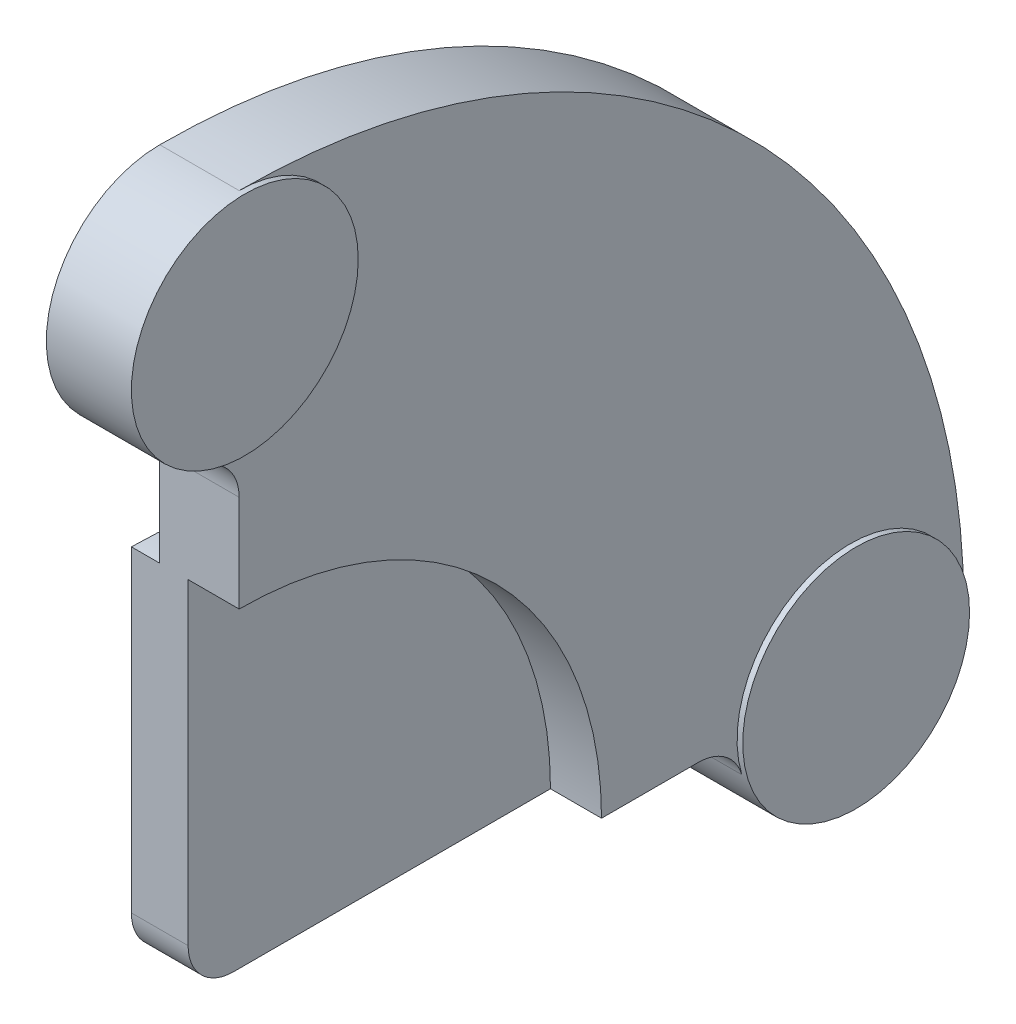
from build123d import *

# Parameters (mm, degrees)
SALIENTE_EXTRUIR1_DEPTH = 2.5
SALIENTE_EXTRUIR2_START = 7
SALIENTE_EXTRUIR2_DEPTH = 7
SALIENTE_EXTRUIR3_START = 7.5
CROQUIS2_4_R            = 10
SALIENTE_EXTRUIR3_DEPTH = 7.5
REDONDEO1_R             = 4
REDONDEO2_R             = 4


with BuildPart() as part:
    # Croquis2 → Saliente-Extruir1 (new, symmetric)
    with BuildSketch(Plane(origin=(0, 0, 0), x_dir=(0, 0, -1), z_dir=(1, 0, 0))):
        with BuildLine():
            ThreePointArc((31.95, 0), (22.592061659, 22.592061659), (0, 31.95))
            Line((0, 31.95), (0, 0))
            Line((0, 0), (31.95, 0))
        make_face()
    extrude(amount=SALIENTE_EXTRUIR1_DEPTH, both=True)

    # Croquis2<3> → Saliente-Extruir2 (add)
    with BuildSketch(Plane(origin=(0, 0, 0), x_dir=(0, 0, -1), z_dir=(1, 0, 0)).offset(SALIENTE_EXTRUIR2_START)):
        with BuildLine():
            ThreePointArc((10, 53.9), (7.071067812, 46.828932188), (0, 43.9))
            Line((0, 43.9), (0, 31.95))
            ThreePointArc((0, 31.95), (22.592061659, 22.592061659), (31.95, 0))
            Line((31.95, 0), (43.9, 0))
            ThreePointArc((43.9, 0), (53.9, 10), (63.9, 0))
            ThreePointArc((63.9, 0), (45.184123318, 45.184123318), (0, 63.9))
            ThreePointArc((0, 63.9), (7.071067812, 60.971067812), (10, 53.9))
        make_face()
    extrude(amount=-SALIENTE_EXTRUIR2_DEPTH)

    # Croquis2<4> → Saliente-Extruir3 (add)
    with BuildSketch(Plane(origin=(0, 0, 0), x_dir=(0, 0, -1), z_dir=(1, 0, 0)).offset(SALIENTE_EXTRUIR3_START)):
        with Locations((0, 53.9)):
            Circle(CROQUIS2_4_R)
        with Locations((53.9, 0)):
            Circle(CROQUIS2_4_R)
    extrude(amount=-SALIENTE_EXTRUIR3_DEPTH)

    # Redondeo1
    redondeo1_edges = [part.edges().sort_by_distance(p)[0] for p in [
        (0, 0, 0),
    ]]
    fillet(redondeo1_edges, radius=REDONDEO1_R)

    # Redondeo2
    redondeo2_edges = [part.edges().sort_by_distance(p)[0] for p in [
        (3.5, 0, -43.9),
        (3.5, 43.9, 0),
    ]]
    fillet(redondeo2_edges, radius=REDONDEO2_R)


solid = part.part
